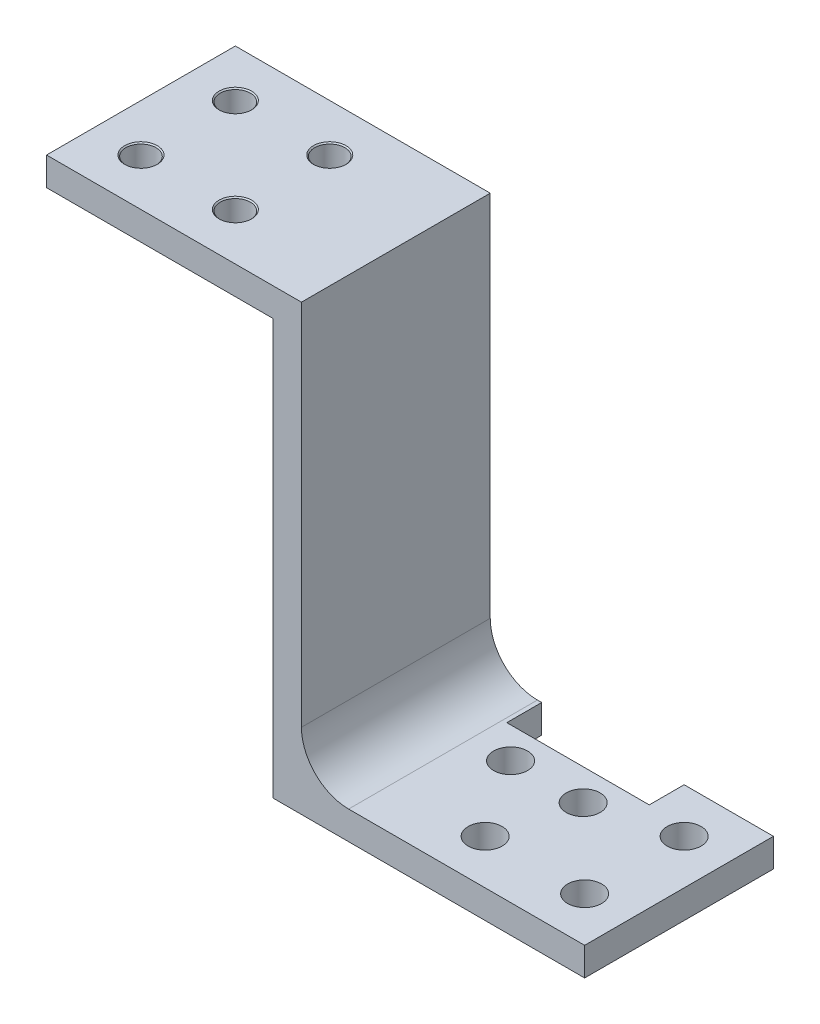
from build123d import *

# Parameters (mm, degrees)
BOSS_EXTRUDE1_DEPTH            = 20
M3_CLEARANCE_HOLE1_D           = 3.2
M3_CLEARANCE_HOLE1_CSINK_D     = 3.45
M3_CLEARANCE_HOLE1_CSINK_ANGLE = 90
SKETCH4_W                      = 15.088998531
SKETCH4_H                      = 3.695589791
CUT_EXTRUDE1_DEPTH             = 75.732857566
M3_CLEARANCE_HOLE2_D           = 3.6
M3_CLEARANCE_HOLE3_D           = 3.6
FILLET1_R                      = 5


with BuildPart() as part:
    # Sketch1 → Boss-Extrude1 (new body)
    with BuildSketch(Plane.XY):
        Polygon((0, 44), (24, 44), (24, 0), (57, 0), (57, 3), (27, 3), (27, 47), (0, 47), align=None)
    extrude(amount=BOSS_EXTRUDE1_DEPTH)

    # M3 Clearance Hole1 (through all)
    with Locations(Plane(origin=(0, 47, 0), x_dir=(1, 0, 0), z_dir=(0, 1, 0))):
        with Locations((15, -15), (5, -5), (5, -15), (15, -5)):
            CounterSinkHole(M3_CLEARANCE_HOLE1_D / 2, M3_CLEARANCE_HOLE1_CSINK_D / 2, counter_sink_angle=M3_CLEARANCE_HOLE1_CSINK_ANGLE)

    # Sketch4 → Cut-Extrude1 (cut, through all)
    with BuildSketch(Plane(origin=(0, 3, 0), x_dir=(1, 0, 0), z_dir=(0, 1, 0))):
        with Locations((39.995300814, -1.847794896)):
            Rectangle(SKETCH4_W, SKETCH4_H)
    extrude(amount=-CUT_EXTRUDE1_DEPTH, mode=Mode.SUBTRACT)

    # M3 Clearance Hole2 (through all)
    with Locations(Plane(origin=(0, 3, 0), x_dir=(1, 0, 0), z_dir=(0, 1, 0))):
        with Locations((36.150801548, -6.995589791), (43.839800079, -6.995589791)):
            Hole(M3_CLEARANCE_HOLE2_D / 2)

    # M3 Clearance Hole3 (through all)
    with Locations(Plane(origin=(0, 3, 0), x_dir=(1, 0, 0), z_dir=(0, 1, 0))):
        with Locations((41.730099961, -15.269900039), (52.269900039, -15.269900039), (52.269900039, -4.730099961)):
            Hole(M3_CLEARANCE_HOLE3_D / 2)

    # Fillet1
    fillet1_edges = [part.edges().sort_by_distance(p)[0] for p in [
        (27, 3, 10),
    ]]
    fillet(fillet1_edges, radius=FILLET1_R)


solid = part.part
